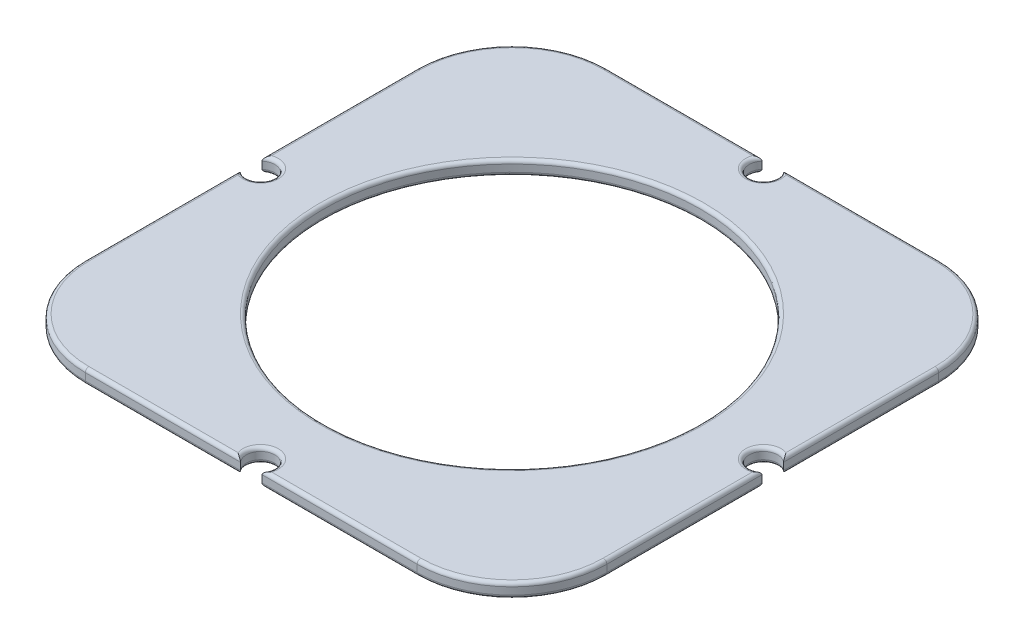
from build123d import *

# Parameters (mm, degrees)
SKETCH1_R                      = 79.5
BOSS_EXTRUDE1_DEPTH            = 6
CBORE_FOR_M10_SHCS_D           = 12
CBORE_FOR_M10_SHCS_CBORE_D     = 18
CBORE_FOR_M10_SHCS_CBORE_DEPTH = 10
FILLET1_R                      = 1.5


with BuildPart() as part:
    # Sketch1 → Boss-Extrude1 (new body)
    with BuildSketch(Plane(origin=(0, 0, 0), x_dir=(1, 0, 0), z_dir=(0, 1, 0))):
        with BuildLine():
            Line((-70, -110), (70, -110))
            ThreePointArc((70, -110), (98.284271247, -98.284271247), (110, -70))
            Line((110, -70), (110, 70))
            ThreePointArc((110, 70), (98.284271247, 98.284271247), (70, 110))
            Line((70, 110), (-70, 110))
            ThreePointArc((-70, 110), (-98.284271247, 98.284271247), (-110, 70))
            Line((-110, 70), (-110, -70))
            ThreePointArc((-110, -70), (-98.284271247, -98.284271247), (-70, -110))
        make_face()
        Circle(SKETCH1_R, mode=Mode.SUBTRACT)
    extrude(amount=BOSS_EXTRUDE1_DEPTH)

    # CBORE for M10 SHCS (through all)
    with Locations(Plane(origin=(0, 21, 0), x_dir=(1, 0, 0), z_dir=(0, 1, 0))):
        with Locations((0, 0), (-106.066017178, 0), (0, 106.066017178), (106.066017178, 0), (0, -106.066017178), (176.776695297, 176.776695297), (-176.776695297, 176.776695297), (176.776695297, -176.776695297), (-176.776695297, -176.776695297)):
            CounterBoreHole(CBORE_FOR_M10_SHCS_D / 2, CBORE_FOR_M10_SHCS_CBORE_D / 2, CBORE_FOR_M10_SHCS_CBORE_DEPTH)

    # Fillet1
    fillet1_edges = [part.edges().sort_by_distance(p)[0] for p in [
        (-79.5, 0, 0),
        (37.265158888, 0, 110),
        (-37.265158888, 0, 110),
        (98.284271247, 0, 98.284271247),
        (110, 0, -37.265158888),
        (110, 0, 37.265158888),
        (98.284271247, 0, -98.284271247),
        (-37.265158888, 0, -110),
        (37.265158888, 0, -110),
        (-98.284271247, 0, -98.284271247),
        (-110, 0, -37.265158888),
        (-110, 0, 37.265158888),
        (-98.284271247, 0, 98.284271247),
        (-79.5, 6, 0),
        (-110, 6, -37.265158888),
        (-110, 6, 37.265158888),
        (-98.284271247, 6, -98.284271247),
        (37.265158888, 6, -110),
        (-37.265158888, 6, -110),
        (98.284271247, 6, -98.284271247),
        (110, 6, 37.265158888),
        (110, 6, -37.265158888),
        (98.284271247, 6, 98.284271247),
        (-37.265158888, 6, 110),
        (37.265158888, 6, 110),
        (-98.284271247, 6, 98.284271247),
        (0, 0, 100.066017178),
        (100.066017178, 0, 0),
        (0, 0, -100.066017178),
        (-100.066017178, 0, 0),
        (0, 6, 100.066017178),
        (100.066017178, 6, 0),
        (0, 6, -100.066017178),
        (-100.066017178, 6, 0),
    ]]
    fillet(fillet1_edges, radius=FILLET1_R)


solid = part.part
